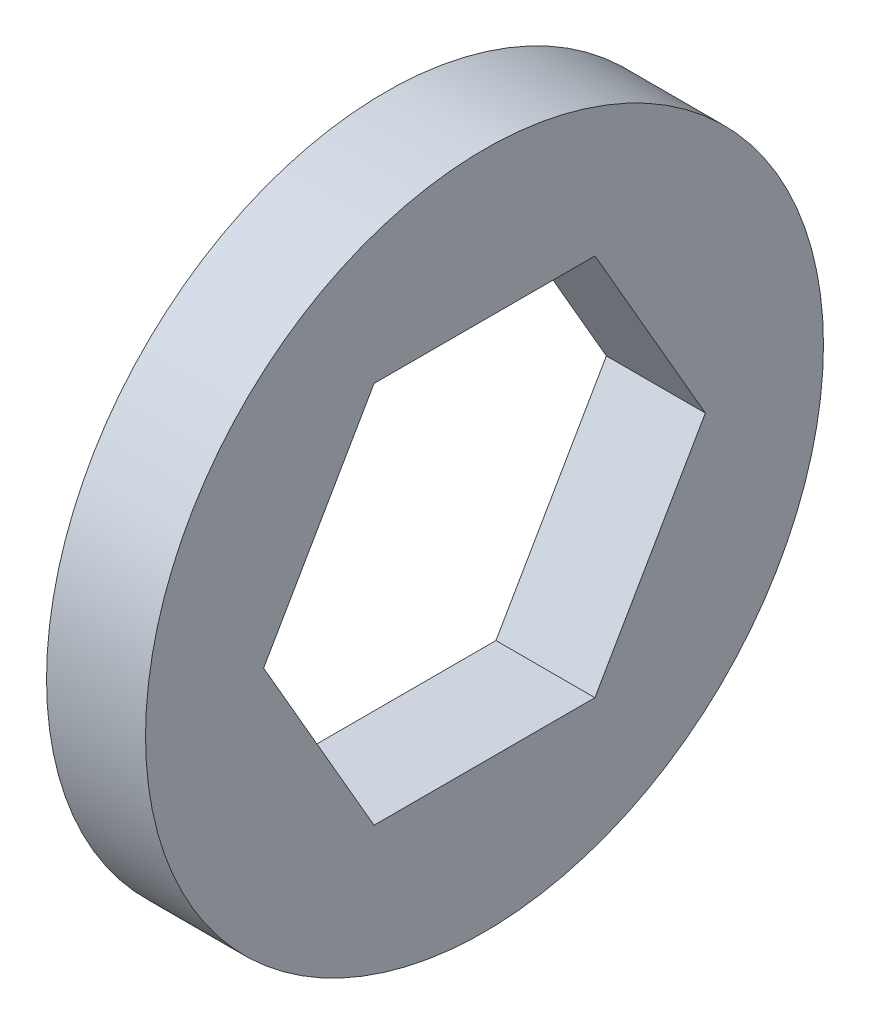
from build123d import *

# Parameters (mm, degrees)
SKETCH1_R           = 8.89
BOSS_EXTRUDE1_DEPTH = 1.29794


with BuildPart() as part:
    # Sketch1 → Boss-Extrude1 (new, symmetric)
    with BuildSketch(Plane(origin=(0, 0, 0), x_dir=(0, 0, -1), z_dir=(1, 0, 0))):
        Circle(SKETCH1_R)
        Polygon((-5.792555251, 0), (-2.896277625, -5.0165), (2.896277625, -5.0165), (5.792555251, 0), (2.896277625, 5.0165), (-2.896277625, 5.0165), align=None, mode=Mode.SUBTRACT)
    extrude(amount=BOSS_EXTRUDE1_DEPTH, both=True)


solid = part.part
